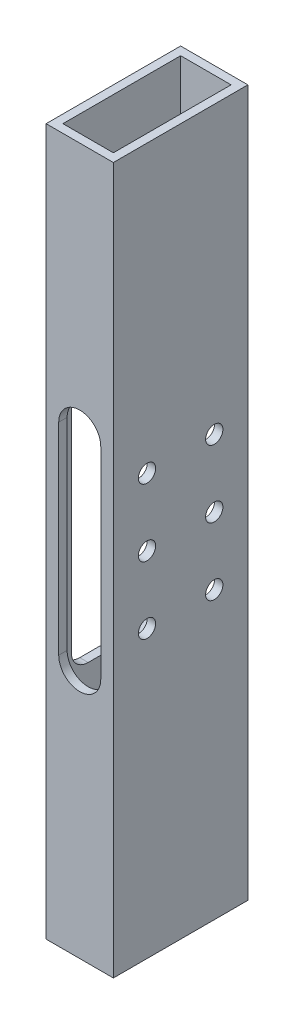
from build123d import *

# Parameters (mm, degrees)
SKETCH1_W           = 25.4
SKETCH1_H           = 50.8
SKETCH1_W_2         = 19.05
SKETCH1_H_2         = 44.45
BOSS_EXTRUDE1_DEPTH = 266.7
SKETCH2_R           = 3.2639
CUT_EXTRUDE1_DEPTH  = 3.175
CUT_EXTRUDE2_DEPTH  = 272.7918689
SKETCH4_W           = 38.1
SKETCH4_H           = 95.25
CUT_EXTRUDE3_DEPTH  = 6.35
FILLET1_R           = 6.35


with BuildPart() as part:
    # Sketch1 → Boss-Extrude1 (new body)
    with BuildSketch(Plane(origin=(0, 0, 0), x_dir=(1, 0, 0), z_dir=(0, 1, 0))):
        Rectangle(SKETCH1_W, SKETCH1_H)
        Rectangle(SKETCH1_W_2, SKETCH1_H_2, mode=Mode.SUBTRACT)
    extrude(amount=BOSS_EXTRUDE1_DEPTH)

    # Sketch2 → Cut-Extrude1 (cut)
    with BuildSketch(Plane(origin=(12.7, 0, 0), x_dir=(0, 0, -1), z_dir=(1, 0, 0))):
        with Locations((-12.7, 158.75)):
            Circle(SKETCH2_R)
        with Locations((12.7, 158.75)):
            Circle(SKETCH2_R)
        with Locations((12.7, 133.35)):
            Circle(SKETCH2_R)
        with Locations((12.7, 107.95)):
            Circle(SKETCH2_R)
        with Locations((-12.7, 133.35)):
            Circle(SKETCH2_R)
        with Locations((-12.7, 107.95)):
            Circle(SKETCH2_R)
    extrude(amount=-CUT_EXTRUDE1_DEPTH, mode=Mode.SUBTRACT)

    # Sketch3 → Cut-Extrude2 (cut, through all)
    with BuildSketch(Plane.XY.offset(25.4)):
        with BuildLine():
            Line((-7.9375, 95.25), (-7.9375, 171.45))
            ThreePointArc((-7.9375, 171.45), (0, 179.3875), (7.9375, 171.45))
            Line((7.9375, 171.45), (7.9375, 95.25))
            ThreePointArc((7.9375, 95.25), (0, 87.3125), (-7.9375, 95.25))
        make_face()
    extrude(amount=-CUT_EXTRUDE2_DEPTH, mode=Mode.SUBTRACT)

    # Sketch4 → Cut-Extrude3 (cut)
    with BuildSketch(Plane.ZY.offset(12.7)):
        with Locations((0, 133.35)):
            Rectangle(SKETCH4_W, SKETCH4_H)
    extrude(amount=-CUT_EXTRUDE3_DEPTH, mode=Mode.SUBTRACT)

    # Fillet1
    fillet1_edges = [part.edges().sort_by_distance(p)[0] for p in [
        (-11.1125, 85.725, -19.05),
        (-11.1125, 85.725, 19.05),
        (-11.1125, 180.975, 19.05),
        (-11.1125, 180.975, -19.05),
    ]]
    fillet(fillet1_edges, radius=FILLET1_R)


solid = part.part
